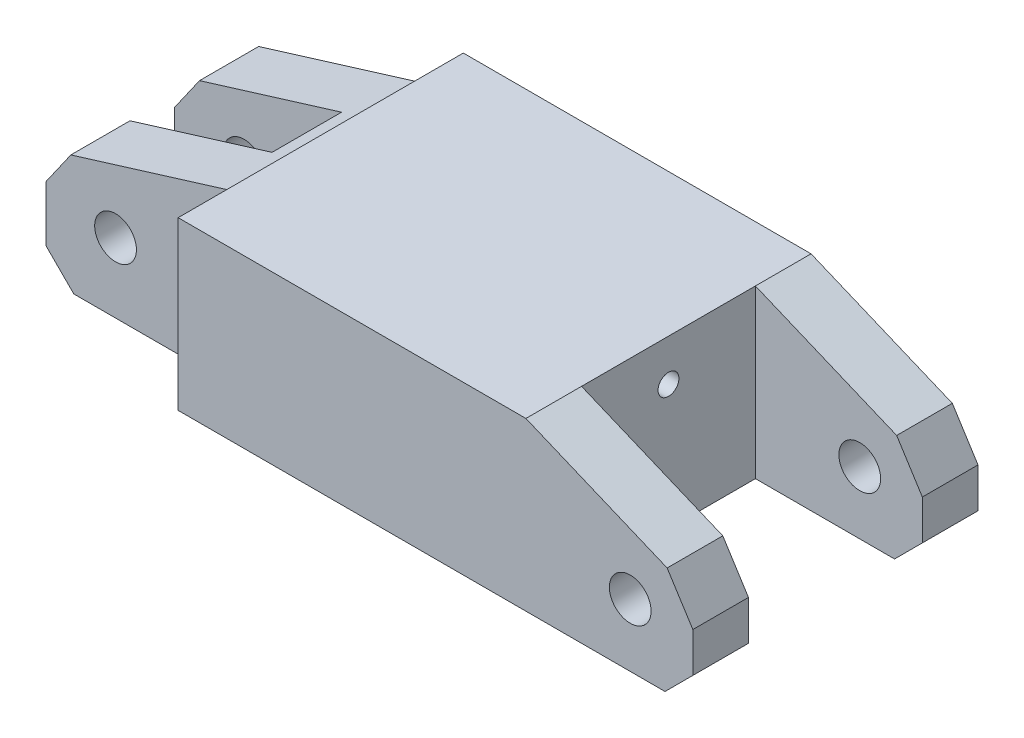
from build123d import *
from OCP.BRepFilletAPI import BRepFilletAPI_MakeChamfer

# Parameters (mm, degrees)
SKETCH_2_W            = 20.5
SKETCH_2_H            = 12
EXTRUDE_1_DEPTH       = 50
SKETCH_3_W            = 24
SKETCH_3_H            = 5
CUT_EXTRUDE_1_DEPTH   = 53.431502935
SKETCH_5_W            = 13.122567423
SKETCH_5_H            = 12.5
CUT_EXTRUDE_2_DEPTH   = 53.431502935
SKETCH_7_R            = 0.75
CUT_EXTRUDE_3_DEPTH   = 40.812843405
SKETCH_10_W           = 19.106520138
SKETCH_10_H           = 8.700699496
CUT_EXTRUDE_3_2_DEPTH = 53.431502935
SKETCH_11_R           = 1.5
CUT_EXTRUDE_6_DEPTH   = 54.150729064
SKETCH_9_R            = 1.5
CUT_EXTRUDE_5_DEPTH   = 55.371407927
SKETCH_12_R           = 0.75
CUT_EXTRUDE_4_DEPTH   = 12
CUT_EXTRUDE_7_DEPTH   = 55.371407927
CHAMFER_5_SIZE        = 2
CHAMFER_6_SIZE        = 2
CHAMFER_6_SIZE2       = 1.867573994
CHAMFER_6_SIZE2_2     = 2.1420728
SKETCH_14_R           = 0.75
CUT_EXTRUDE_5_2_DEPTH = 6
CUT_EXTRUDE_8_DEPTH   = 10
SKETCH_16_R           = 0.75
CUT_EXTRUDE_9_DEPTH   = 5


with BuildPart() as part:
    # Эскиз2 → Вытянуть1 (new body)
    with BuildSketch(Plane(origin=(0, 0, 0), x_dir=(0, 0, -1), z_dir=(1, 0, 0))):
        Rectangle(SKETCH_2_W, SKETCH_2_H)
    extrude(amount=EXTRUDE_1_DEPTH)

    # Эскиз3 → Вырез-Вытянуть1 (cut, through all)
    with BuildSketch(Plane(origin=(0, 6, 0), x_dir=(1, 0, 0), z_dir=(0, 1, 0))):
        Rectangle(SKETCH_3_W, SKETCH_3_H)
    extrude(amount=-CUT_EXTRUDE_1_DEPTH, mode=Mode.SUBTRACT)

    # Эскиз5 → Вырез-Вытянуть2 (cut, through all)
    with BuildSketch(Plane(origin=(0, 6, 0), x_dir=(1, 0, 0), z_dir=(0, 1, 0))):
        with Locations((44.561283712, 0)):
            Rectangle(SKETCH_5_W, SKETCH_5_H)
    extrude(amount=-CUT_EXTRUDE_2_DEPTH, mode=Mode.SUBTRACT)

    # Эскиз7 → Cut-Extrude 3 (cut, through all)
    with BuildSketch(Plane(origin=(38, 0, 0), x_dir=(0, 0, -1), z_dir=(1, 0, 0))):
        with Locations((0, 3)):
            Circle(SKETCH_7_R)
    extrude(amount=-CUT_EXTRUDE_3_DEPTH, mode=Mode.SUBTRACT)

    # Эскиз10 → Cut-Extrude 3 2 (cut, through all)
    with BuildSketch(Plane(origin=(0, 6, 0), x_dir=(1, 0, 0), z_dir=(0, 1, 0))):
        with Locations((3.446739931, 11.100349748)):
            Rectangle(SKETCH_10_W, SKETCH_10_H)
        with Locations((3.446739931, -11.100349748)):
            Rectangle(SKETCH_10_W, SKETCH_10_H)
    extrude(amount=-CUT_EXTRUDE_3_2_DEPTH, mode=Mode.SUBTRACT)

    # Эскиз11 → Вытянуть6 (cut, through all)
    with BuildSketch(Plane.XY.offset(6.75)):
        with Locations((5, -1)):
            Circle(SKETCH_11_R)
    extrude(amount=-CUT_EXTRUDE_6_DEPTH, mode=Mode.SUBTRACT)

    # Эскиз9 → Cut-Extrude 5 (cut, through all)
    with BuildSketch(Plane.XY.offset(10.25)):
        with Locations((45.5, -1.5)):
            Circle(SKETCH_9_R)
    extrude(amount=-CUT_EXTRUDE_5_DEPTH, mode=Mode.SUBTRACT)

    # Эскиз12 → Вырез-Вытянуть4 (cut)
    with BuildSketch(Plane.ZY.offset(-12)):
        with Locations((-1.791386219, -3.407348241)):
            Circle(SKETCH_12_R)
    extrude(amount=-CUT_EXTRUDE_4_DEPTH, mode=Mode.SUBTRACT)

    # Эскиз13 → Вытянуть7 (cut, through all)
    with BuildSketch(Plane.XY.offset(10.25)):
        Polygon((13, 6), (0, 6), (0, 2), align=None)
        Polygon((50, 6), (50, 1), (38, 6), align=None)
    extrude(amount=-CUT_EXTRUDE_7_DEPTH, mode=Mode.SUBTRACT)

    # Фаска5
    chamfer_5_edges = [part.edges().sort_by_distance(p)[0] for p in [
        (0, -6, 4.625),
        (0, -6, -4.625),
        (50, -6, -8.25),
        (50, -6, 8.25),
    ]]
    chamfer(chamfer_5_edges, length=CHAMFER_5_SIZE)

    # Фаска6: one chamfer whose edges measure the first distance from different faces: ONE call of the kernel's chamfer builder (chamfer() names one face for all edges)
    chamfer_6_edges_1 = [part.edges().sort_by_distance(p)[0] for p in [
        (0, 2, 4.625),
    ]]
    chamfer_6_side_1 = [part.faces().sort_by_distance(p)[0] for p in [
        (0, -1, 4.625),
    ]]
    chamfer_6_edges_2 = [part.edges().sort_by_distance(p)[0] for p in [
        (0, 2, -4.625),
    ]]
    chamfer_6_side_2 = [part.faces().sort_by_distance(p)[0] for p in [
        (0, -1, -4.625),
    ]]
    chamfer_6_edges_3 = [part.edges().sort_by_distance(p)[0] for p in [
        (50, 1, -8.25),
    ]]
    chamfer_6_side_3 = [part.faces().sort_by_distance(p)[0] for p in [
        (44, 3.5, -8.25),
    ]]
    chamfer_6_edges_4 = [part.edges().sort_by_distance(p)[0] for p in [
        (50, 1, 8.25),
    ]]
    chamfer_6_side_4 = [part.faces().sort_by_distance(p)[0] for p in [
        (44, 3.5, 8.25),
    ]]
    chamfer_6 = BRepFilletAPI_MakeChamfer(part.part.solid().wrapped)
    for e in chamfer_6_edges_1:
        chamfer_6.Add(CHAMFER_6_SIZE, CHAMFER_6_SIZE2, e.wrapped, chamfer_6_side_1[0].wrapped)  # the first distance lies on this face
    for e in chamfer_6_edges_2:
        chamfer_6.Add(CHAMFER_6_SIZE, CHAMFER_6_SIZE2, e.wrapped, chamfer_6_side_2[0].wrapped)  # the first distance lies on this face
    for e in chamfer_6_edges_3:
        chamfer_6.Add(CHAMFER_6_SIZE, CHAMFER_6_SIZE2_2, e.wrapped, chamfer_6_side_3[0].wrapped)  # the first distance lies on this face
    for e in chamfer_6_edges_4:
        chamfer_6.Add(CHAMFER_6_SIZE, CHAMFER_6_SIZE2_2, e.wrapped, chamfer_6_side_4[0].wrapped)  # the first distance lies on this face
    add(Compound.cast(chamfer_6.Shape()), mode=Mode.REPLACE)

    # Эскиз14 → Cut-Extrude 5 2 (cut)
    with BuildSketch(Plane(origin=(38, 0, 0), x_dir=(0, 0, -1), z_dir=(1, 0, 0))):
        with Locations((-2, -3.75)):
            Circle(SKETCH_14_R)
    extrude(amount=-CUT_EXTRUDE_5_2_DEPTH, mode=Mode.SUBTRACT)

    # Эскиз15 → Вытянуть8 (cut)
    with BuildSketch(Plane.XZ.offset(6)):
        with BuildLine():
            Line((18, 6.25), (32, 6.25))
            ThreePointArc((32, 6.25), (34.121320344, 5.371320344), (35, 3.25))
            Line((35, 3.25), (35, -3.25))
            ThreePointArc((35, -3.25), (34.121320344, -5.371320344), (32, -6.25))
            Line((32, -6.25), (18, -6.25))
            ThreePointArc((18, -6.25), (15.878679656, -5.371320344), (15, -3.25))
            Line((15, -3.25), (15, 3.25))
            ThreePointArc((15, 3.25), (15.878679656, 5.371320344), (18, 6.25))
        make_face()
    extrude(amount=-CUT_EXTRUDE_8_DEPTH, mode=Mode.SUBTRACT)

    # Эскиз16 → Вытянуть9 (cut)
    with BuildSketch(Plane.ZY.offset(-12)):
        with Locations((1.748401574, 3.000943563)):
            Circle(SKETCH_16_R)
    extrude(amount=-CUT_EXTRUDE_9_DEPTH, mode=Mode.SUBTRACT)


solid = part.part
